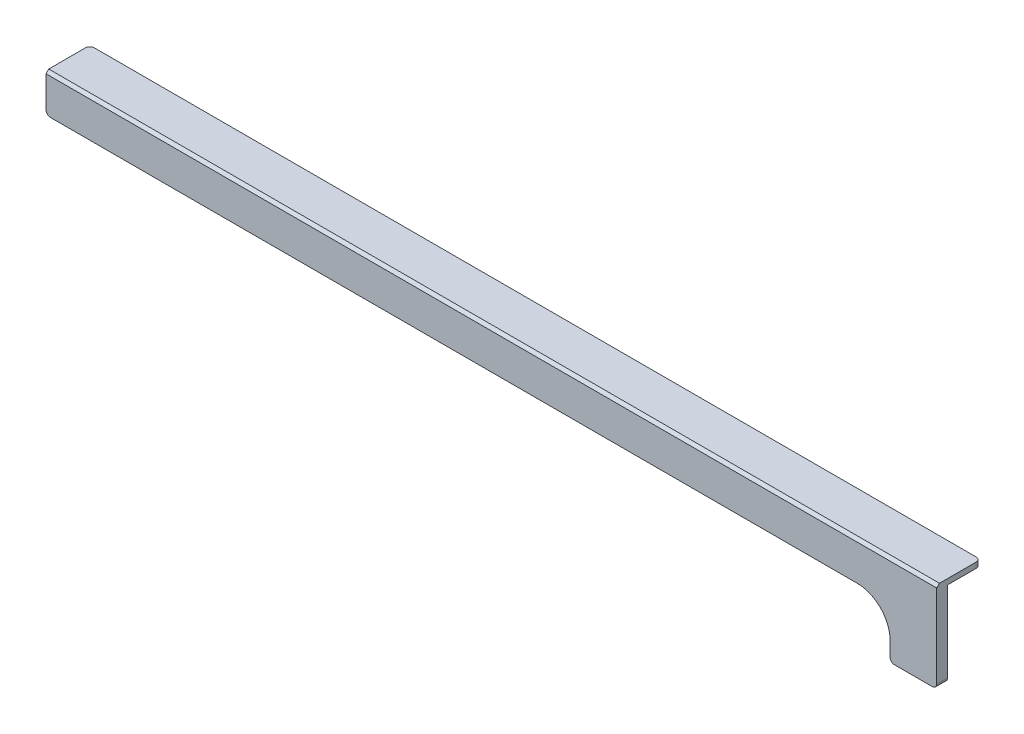
from build123d import *

# Parameters (mm, degrees)
BOSS_EXTRUDE1_DEPTH                          = 4
SKETCH3_W                                    = 324.79935
SKETCH3_H                                    = 12
BOSS_EXTRUDE2_DEPTH                          = 2
FILLET1_SIZE                                 = 1
FILLET2_R                                    = 1.6
FILLET3_R                                    = 12
TAP_DRILL_FOR_M3X0_5_TAP1_D                  = 2.5
TAP_DRILL_FOR_M3X0_5_TAP1_DEPTH              = 7
TAP_DRILL_FOR_M3X0_5_TAP1_CSINK_D            = 2.55
TAP_DRILL_FOR_M3X0_5_TAP1_CSINK_ANGLE        = 90
TAP_DRILL_FOR_M3X0_5_TAP1_TIP                = 0.751075774
CBORE_FOR_M2_5_HEX_SOCKET_HEAD_CAP_S_2_COUNT = 2
CBORE_FOR_M2_5_HEX_SOCKET_HEAD_CAP_S_2_PITCH = 343.798403
CBORE_FOR_M2_5_HEX_SOCKET_HEAD_CAP_S_3_COUNT = 2
CBORE_FOR_M2_5_HEX_SOCKET_HEAD_CAP_S_3_PITCH = 369.079907741
CBORE_FOR_M2_5_HEX_SOCKET_HEAD_CAP_S_4_COUNT = 2
CBORE_FOR_M2_5_HEX_SOCKET_HEAD_CAP_S_4_PITCH = 275.745768266
CBORE_FOR_M2_5_HEX_SOCKET_HEAD_CAP_S_5_COUNT = 2
CBORE_FOR_M2_5_HEX_SOCKET_HEAD_CAP_S_5_PITCH = 169.171931368
CBORE_FOR_M2_5_HEX_SOCKET_HEAD_CAP_S_6_COUNT = 2
CBORE_FOR_M2_5_HEX_SOCKET_HEAD_CAP_S_6_PITCH = 134.248413


with BuildPart() as part:
    # Sketch2 → Boss-Extrude1 (new body)
    with BuildSketch(Plane.XY.offset(14.1038)):
        Polygon((-159.224575, 59.6246), (-159.224575, 73.6246), (165.574775, 73.6246), (165.574775, 59.6246), (165.574775, 40.6744), (148.575775, 40.6744), (148.575775, 59.6246), align=None)
    extrude(amount=-BOSS_EXTRUDE1_DEPTH)

    # Sketch3 → Boss-Extrude2 (add)
    with BuildSketch(Plane(origin=(0, 73.6246, 0), x_dir=(1, 0, 0), z_dir=(0, 1, 0))):
        with Locations((3.1751, -4.1038)):
            Rectangle(SKETCH3_W, SKETCH3_H)
    extrude(amount=-BOSS_EXTRUDE2_DEPTH)

    # Fillet1
    fillet1_edges = [part.edges().sort_by_distance(p)[0] for p in [
        (3.1751, 73.6246, 14.1038),
    ]]
    chamfer(fillet1_edges, length=FILLET1_SIZE)

    # Fillet2
    fillet2_edges = [part.edges().sort_by_distance(p)[0] for p in [
        (-159.224575, 72.6246, -1.8962),
        (165.574775, 72.6246, -1.8962),
        (165.574775, 40.6744, 12.1038),
        (148.575775, 40.6744, 12.1038),
        (-159.224575, 59.6246, 12.1038),
    ]]
    fillet(fillet2_edges, radius=FILLET2_R)

    # Fillet3
    fillet3_edges = [part.edges().sort_by_distance(p)[0] for p in [
        (148.575775, 59.6246, 12.1038),
    ]]
    fillet(fillet3_edges, radius=FILLET3_R)

    # Tap Drill for M3x0.5 Tap1
    with Locations(Plane(origin=(0, 0, 5.0798), x_dir=(-1, 0, 0), z_dir=(0, 0, -1))):
        with Locations((-106.614905, 66.623653), (-37.655035, 66.623653), (31.304835, 66.623653), (100.264705, 66.623653), (100.264705, -66.62476), (31.304835, -66.62476), (-37.655035, -66.62476), (-106.614905, -66.62476)):
            CounterSinkHole(TAP_DRILL_FOR_M3X0_5_TAP1_D / 2, TAP_DRILL_FOR_M3X0_5_TAP1_CSINK_D / 2, depth=TAP_DRILL_FOR_M3X0_5_TAP1_DEPTH, counter_sink_angle=TAP_DRILL_FOR_M3X0_5_TAP1_CSINK_ANGLE)
            with Locations((0, 0, -(TAP_DRILL_FOR_M3X0_5_TAP1_DEPTH + TAP_DRILL_FOR_M3X0_5_TAP1_TIP / 2))):  # 118° drill point
                Cone(0, TAP_DRILL_FOR_M3X0_5_TAP1_D / 2, TAP_DRILL_FOR_M3X0_5_TAP1_TIP, mode=Mode.SUBTRACT)

    # Sketch7 → CBORE for M2.5 Hex Socket Head Cap Screw1 (revolve, cut)
    with BuildSketch(Plane(origin=(-168.7241015, -67.1242865, -6), x_dir=(0, 1, 0), z_dir=(1, 0, 0))):
        Polygon((0, 0), (0, 18.871247898), (1.45, 18), (1.45, 5.9), (2.75, 5.9), (2.75, 0.025), (2.775, 0), align=None)
    cbore_for_m2_5_hex_socket_head_cap_screw = revolve(axis=Axis((-168.7241015, -67.1242865, -12.35), (0, 0, 1)), mode=Mode.SUBTRACT)

    # CBORE for M2.5 Hex Socket Head Cap S 2: CBORE for M2.5 Hex Socket Head Cap Screw1 ×2
    with Locations(*[(i * CBORE_FOR_M2_5_HEX_SOCKET_HEAD_CAP_S_2_PITCH, 0, 0) for i in range(1, CBORE_FOR_M2_5_HEX_SOCKET_HEAD_CAP_S_2_COUNT)]):
        add(cbore_for_m2_5_hex_socket_head_cap_screw, mode=Mode.SUBTRACT)

    # CBORE for M2.5 Hex Socket Head Cap S 3: CBORE for M2.5 Hex Socket Head Cap Screw1 ×2
    with Locations(*[Vector(0.9315012705620509, 0.3637380691394355, 0) * (i * CBORE_FOR_M2_5_HEX_SOCKET_HEAD_CAP_S_3_PITCH) for i in range(1, CBORE_FOR_M2_5_HEX_SOCKET_HEAD_CAP_S_3_COUNT)]):
        add(cbore_for_m2_5_hex_socket_head_cap_screw, mode=Mode.SUBTRACT)

    # CBORE for M2.5 Hex Socket Head Cap S 4: CBORE for M2.5 Hex Socket Head Cap Screw1 ×2
    with Locations(*[Vector(0.873482385656236, 0.48685575065751296, 0) * (i * CBORE_FOR_M2_5_HEX_SOCKET_HEAD_CAP_S_4_PITCH) for i in range(1, CBORE_FOR_M2_5_HEX_SOCKET_HEAD_CAP_S_4_COUNT)]):
        add(cbore_for_m2_5_hex_socket_head_cap_screw, mode=Mode.SUBTRACT)

    # CBORE for M2.5 Hex Socket Head Cap S 5: CBORE for M2.5 Hex Socket Head Cap Screw1 ×2
    with Locations(*[Vector(0.6084894265127476, 0.7935619810841417, 0) * (i * CBORE_FOR_M2_5_HEX_SOCKET_HEAD_CAP_S_5_PITCH) for i in range(1, CBORE_FOR_M2_5_HEX_SOCKET_HEAD_CAP_S_5_COUNT)]):
        add(cbore_for_m2_5_hex_socket_head_cap_screw, mode=Mode.SUBTRACT)

    # CBORE for M2.5 Hex Socket Head Cap S 6: CBORE for M2.5 Hex Socket Head Cap Screw1 ×2
    with Locations(*[(0, i * CBORE_FOR_M2_5_HEX_SOCKET_HEAD_CAP_S_6_PITCH, 0) for i in range(1, CBORE_FOR_M2_5_HEX_SOCKET_HEAD_CAP_S_6_COUNT)]):
        add(cbore_for_m2_5_hex_socket_head_cap_screw, mode=Mode.SUBTRACT)


solid = part.part
